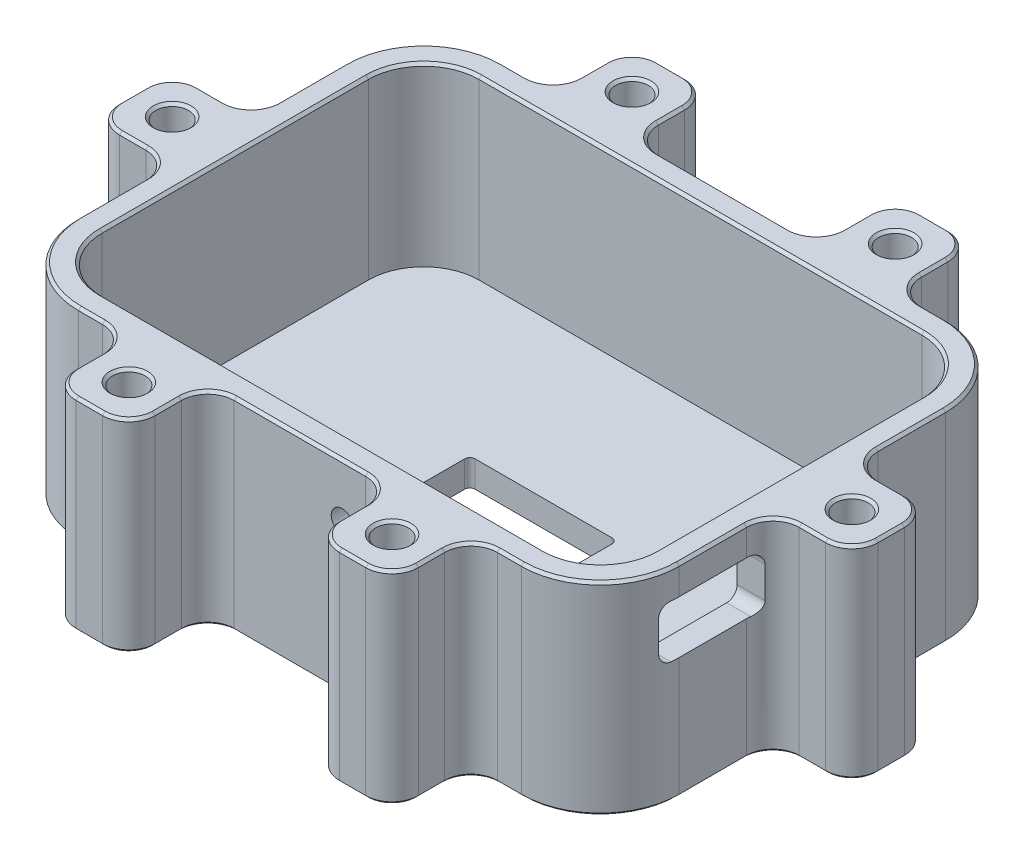
from build123d import *

# Parameters (mm, degrees)
BODY_DELETE_KEEP_START     = 12.456690851
BODY_DELETE_KEEP_1_DEPTH   = 38.5
BODY_DELETE_KEEP_1_2_DEPTH = 5
SKETCH121_W                = 15
SKETCH121_H                = 38.5
BOSS_EXTRUDE1_DEPTH        = 15
SKETCH122_W                = 15
SKETCH122_H                = 38.5
BOSS_EXTRUDE2_DEPTH        = 15
SKETCH123_R                = 3.1
CUT_EXTRUDE1_DEPTH         = 245.273833572
SKETCH124_R                = 3.1
CUT_EXTRUDE2_DEPTH         = 245.273833572
MIRROR3_COPY_1_SKETCH_W    = 15
MIRROR3_COPY_1_SKETCH_H    = 38.5
MIRROR3_COPY_1_DEPTH       = 15
MIRROR3_COPY_2_SKETCH_R    = 3.1
MIRROR3_COPY_2_DEPTH       = 245.273833572
FILLET1_R                  = 5
CHAMFER1_SIZE              = 0.5
SKETCH125_W                = 19
SKETCH125_H                = 10
CUT_EXTRUDE3_DEPTH         = 10
SKETCH127_W                = 28
SKETCH127_H                = 12
CUT_EXTRUDE4_DEPTH         = 5
FILLET2_R                  = 1
SKETCH128_R                = 1.5
CUT_EXTRUDE5_DEPTH         = 4.5
M5X0_8_TAPPED_HOLE1_D      = 4.2
M5X0_8_TAPPED_HOLE1_DEPTH  = 14
M5X0_8_TAPPED_HOLE1_TIP    = 1.2618073
FILLET3_R                  = 2


# Read off the part's stored shape, not the designer's step: Body-Delete/Keep 1
with BuildPart() as part:
    # Body-Delete/Keep 1 outline → Body-Delete/Keep 1 (new body)
    with BuildSketch(Plane(origin=(0, 0, 0), x_dir=(1, 0, 0), z_dir=(0, 1, 0)).offset(BODY_DELETE_KEEP_START)):
        with BuildLine():
            ThreePointArc((-96.863777431, -3.776261632), (-101.257175713, 6.830340086), (-111.863777431, 11.223738368))
            Line((-111.863777431, 11.223738368), (-195.989813257, 11.223738368))
            ThreePointArc((-195.989813257, 11.223738368), (-206.596414975, 6.830340086), (-210.989813257, -3.776261632))
            Line((-210.989813257, -3.776261632), (-210.989813257, -54.356742894))
            ThreePointArc((-210.989813257, -54.356742894), (-206.596414975, -64.963344612), (-195.989813257, -69.356742894))
            Line((-195.989813257, -69.356742894), (-111.863777431, -69.356742894))
            ThreePointArc((-111.863777431, -69.356742894), (-101.257175713, -64.963344612), (-96.863777431, -54.356742894))
            Line((-96.863777431, -54.356742894), (-96.863777431, -3.776261632))
        make_face()
        with BuildLine():
            Line((-195.989813257, 6.723738368), (-111.863777431, 6.723738368))
            ThreePointArc((-111.863777431, 6.723738368), (-104.439156228, 3.648359571), (-101.363777431, -3.776261632))
            Line((-101.363777431, -3.776261632), (-101.363777431, -54.356742894))
            ThreePointArc((-101.363777431, -54.356742894), (-104.439156228, -61.781364097), (-111.863777431, -64.856742894))
            Line((-111.863777431, -64.856742894), (-195.989813257, -64.856742894))
            ThreePointArc((-195.989813257, -64.856742894), (-203.41443446, -61.781364097), (-206.489813257, -54.356742894))
            Line((-206.489813257, -54.356742894), (-206.489813257, -3.776261632))
            ThreePointArc((-206.489813257, -3.776261632), (-203.41443446, 3.648359571), (-195.989813257, 6.723738368))
        make_face(mode=Mode.SUBTRACT)
    extrude(amount=BODY_DELETE_KEEP_1_DEPTH)

    # Body-Delete_Keep 1 2 outline → Body-Delete_Keep 1 2 (add)
    with BuildSketch(Plane(origin=(0, 0, 0), x_dir=(1, 0, 0), z_dir=(0, 1, 0)).offset(BODY_DELETE_KEEP_START)):
        with BuildLine():
            ThreePointArc((-101.363777431, -3.776261632), (-104.439156228, 3.648359571), (-111.863777431, 6.723738368))
            Line((-111.863777431, 6.723738368), (-195.989813257, 6.723738368))
            ThreePointArc((-195.989813257, 6.723738368), (-203.41443446, 3.648359571), (-206.489813257, -3.776261632))
            Line((-206.489813257, -3.776261632), (-206.489813257, -54.356742894))
            ThreePointArc((-206.489813257, -54.356742894), (-203.41443446, -61.781364097), (-195.989813257, -64.856742894))
            Line((-195.989813257, -64.856742894), (-111.863777431, -64.856742894))
            ThreePointArc((-111.863777431, -64.856742894), (-104.439156228, -61.781364097), (-101.363777431, -54.356742894))
            Line((-101.363777431, -54.356742894), (-101.363777431, -3.776261632))
        make_face()
    extrude(amount=BODY_DELETE_KEEP_1_2_DEPTH)

    # Sketch121 → Boss-Extrude1 (add)
    with BuildSketch(Plane.ZY.offset(210.989813257)):
        with Locations((29.066502263, 31.706690851)):
            Rectangle(SKETCH121_W, SKETCH121_H)
    boss_extrude1 = extrude(amount=BOSS_EXTRUDE1_DEPTH)

    # Sketch122 → Boss-Extrude2 (add)
    with BuildSketch(Plane.XY.offset(69.356742894)):
        with Locations((-178.926795344, 31.706690851)):
            Rectangle(SKETCH122_W, SKETCH122_H)
    boss_extrude2 = extrude(amount=BOSS_EXTRUDE2_DEPTH)

    # Sketch123 → Cut-Extrude1 (cut, through all)
    with BuildSketch(Plane(origin=(0, 50.956690851, 0), x_dir=(1, 0, 0), z_dir=(0, 1, 0))):
        with Locations(Location((-218.489813257, -29.066502263, 0), (0, 0, 270))):
            Circle(SKETCH123_R)
    cut_extrude1 = extrude(amount=-CUT_EXTRUDE1_DEPTH, mode=Mode.SUBTRACT)

    # Sketch124 → Cut-Extrude2 (cut, through all)
    with BuildSketch(Plane(origin=(0, 50.956690851, 0), x_dir=(1, 0, 0), z_dir=(0, 1, 0))):
        with Locations(Location((-178.926795344, -76.856742894, 0), (0, 0, 270))):
            Circle(SKETCH124_R)
    cut_extrude2 = extrude(amount=-CUT_EXTRUDE2_DEPTH, mode=Mode.SUBTRACT)

    # Mirror1: Boss-Extrude1, Cut-Extrude1 across plane
    add(boss_extrude1.mirror(Plane.ZY.offset(153.926795344)))
    add(cut_extrude1.mirror(Plane.ZY.offset(153.926795344)), mode=Mode.SUBTRACT)

    # Mirror2: Boss-Extrude2, Cut-Extrude2 across plane
    add(boss_extrude2.mirror(Plane.XY.offset(29.066502263)))
    add(cut_extrude2.mirror(Plane.XY.offset(29.066502263)), mode=Mode.SUBTRACT)

    # Mirror3: Boss-Extrude2, Cut-Extrude2 across plane
    add(boss_extrude2.mirror(Plane.ZY.offset(153.926795344)))
    add(cut_extrude2.mirror(Plane.ZY.offset(153.926795344)), mode=Mode.SUBTRACT)

    # Mirror3 copy 1 sketch → Mirror3 copy 1 (add)
    with BuildSketch(Plane(origin=(-307.853590688, 0, -11.223738368), x_dir=(-1, 0, 0), z_dir=(0, 0, -1))):
        with Locations((-178.926795344, 31.706690851)):
            Rectangle(MIRROR3_COPY_1_SKETCH_W, MIRROR3_COPY_1_SKETCH_H)
    extrude(amount=MIRROR3_COPY_1_DEPTH)

    # Mirror3 copy 2 sketch → Mirror3 copy 2 (cut, through all)
    with BuildSketch(Plane(origin=(-307.853590688, 50.956690851, 58.133004526), x_dir=(-1, 0, 0), z_dir=(0, 1, 0))):
        with Locations(Location((-178.926795344, -76.856742894, 0), (0, 0, 270))):
            Circle(MIRROR3_COPY_2_SKETCH_R)
    extrude(amount=-MIRROR3_COPY_2_DEPTH, mode=Mode.SUBTRACT)

    # Fillet1
    fillet1_edges = [part.edges().sort_by_distance(p)[0] for p in [
        (-81.863777431, 31.706690851, 21.566502263),
        (-81.863777431, 31.706690851, 36.566502263),
        (-96.863777431, 31.706690851, 21.566502263),
        (-96.863777431, 31.706690851, 36.566502263),
        (-186.426795344, 31.706690851, -26.223738368),
        (-171.426795344, 31.706690851, -26.223738368),
        (-186.426795344, 31.706690851, -11.223738368),
        (-171.426795344, 31.706690851, -11.223738368),
        (-121.426795344, 31.706690851, -11.223738368),
        (-136.426795344, 31.706690851, -11.223738368),
        (-121.426795344, 31.706690851, -26.223738368),
        (-136.426795344, 31.706690851, -26.223738368),
        (-121.426795344, 31.706690851, 84.356742894),
        (-136.426795344, 31.706690851, 84.356742894),
        (-121.426795344, 31.706690851, 69.356742894),
        (-136.426795344, 31.706690851, 69.356742894),
        (-210.989813257, 31.706690851, 21.566502263),
        (-210.989813257, 31.706690851, 36.566502263),
        (-225.989813257, 31.706690851, 21.566502263),
        (-225.989813257, 31.706690851, 36.566502263),
        (-186.426795344, 31.706690851, 69.356742894),
        (-171.426795344, 31.706690851, 69.356742894),
        (-186.426795344, 31.706690851, 84.356742894),
        (-171.426795344, 31.706690851, 84.356742894),
    ]]
    fillet(fillet1_edges, radius=FILLET1_R)

    # Chamfer1
    chamfer1_edges = [part.edges().sort_by_distance(p)[0] for p in [
        (-206.596414975, 50.956690851, -6.830340086),
        (-218.489813257, 12.456690851, 25.966502263),
        (-218.489813257, 50.956690851, 25.966502263),
        (-178.926795344, 12.456690851, 73.756742894),
        (-178.926795344, 50.956690851, 73.756742894),
        (-210.989813257, 50.956690851, 47.961622578),
        (-89.363777431, 50.956690851, 25.966502263),
        (-89.363777431, 12.456690851, 25.966502263),
        (-206.596414975, 50.956690851, 64.963344612),
        (-178.926795344, 50.956690851, -15.623738368),
        (-178.926795344, 12.456690851, -15.623738368),
        (-114.145286388, 50.956690851, 69.356742894),
        (-128.926795344, 12.456690851, -15.623738368),
        (-128.926795344, 50.956690851, -15.623738368),
        (-101.257175713, 50.956690851, 64.963344612),
        (-128.926795344, 50.956690851, 73.756742894),
        (-128.926795344, 12.456690851, 73.756742894),
        (-121.426795344, 12.456690851, -18.723738368),
        (-121.426795344, 50.956690851, -18.723738368),
        (-114.145286388, 12.456690851, -11.223738368),
        (-114.145286388, 50.956690851, -11.223738368),
        (-128.926795344, 12.456690851, -26.223738368),
        (-128.926795344, 50.956690851, -26.223738368),
        (-89.363777431, 12.456690851, 21.566502263),
        (-81.863777431, 12.456690851, 29.066502263),
        (-96.863777431, 50.956690851, 10.171381947),
        (-89.363777431, 12.456690851, 36.566502263),
        (-96.863777431, 12.456690851, 47.961622578),
        (-121.426795344, 12.456690851, 76.856742894),
        (-128.926795344, 12.456690851, 84.356742894),
        (-136.426795344, 12.456690851, 76.856742894),
        (-153.926795344, 12.456690851, 69.356742894),
        (-171.426795344, 12.456690851, 76.856742894),
        (-178.926795344, 12.456690851, 84.356742894),
        (-186.426795344, 12.456690851, 76.856742894),
        (-193.708304301, 12.456690851, 69.356742894),
        (-218.489813257, 12.456690851, 36.566502263),
        (-225.989813257, 12.456690851, 29.066502263),
        (-218.489813257, 12.456690851, 21.566502263),
        (-210.989813257, 12.456690851, 10.171381947),
        (-186.426795344, 12.456690851, -18.723738368),
        (-178.926795344, 12.456690851, -26.223738368),
        (-171.426795344, 12.456690851, -18.723738368),
        (-153.926795344, 12.456690851, -11.223738368),
        (-136.426795344, 12.456690851, -18.723738368),
        (-224.525347163, 12.456690851, 35.102036169),
        (-83.328243525, 12.456690851, 23.030968357),
        (-83.328243525, 12.456690851, 35.102036169),
        (-122.891261438, 12.456690851, 82.8922768),
        (-134.96232925, 12.456690851, 82.8922768),
        (-172.891261438, 12.456690851, 82.8922768),
        (-184.96232925, 12.456690851, 82.8922768),
        (-224.525347163, 12.456690851, 23.030968357),
        (-184.96232925, 12.456690851, -24.759272274),
        (-172.891261438, 12.456690851, -24.759272274),
        (-134.96232925, 12.456690851, -24.759272274),
        (-122.891261438, 12.456690851, -24.759272274),
        (-136.426795344, 50.956690851, -18.723738368),
        (-153.926795344, 50.956690851, -11.223738368),
        (-171.426795344, 50.956690851, -18.723738368),
        (-178.926795344, 50.956690851, -26.223738368),
        (-186.426795344, 50.956690851, -18.723738368),
        (-210.989813257, 50.956690851, 10.171381947),
        (-218.489813257, 50.956690851, 21.566502263),
        (-225.989813257, 50.956690851, 29.066502263),
        (-218.489813257, 50.956690851, 36.566502263),
        (-193.708304301, 50.956690851, 69.356742894),
        (-186.426795344, 50.956690851, 76.856742894),
        (-178.926795344, 50.956690851, 84.356742894),
        (-171.426795344, 50.956690851, 76.856742894),
        (-153.926795344, 50.956690851, 69.356742894),
        (-136.426795344, 50.956690851, 76.856742894),
        (-128.926795344, 50.956690851, 84.356742894),
        (-121.426795344, 50.956690851, 76.856742894),
        (-96.863777431, 50.956690851, 47.961622578),
        (-89.363777431, 50.956690851, 36.566502263),
        (-81.863777431, 50.956690851, 29.066502263),
        (-89.363777431, 50.956690851, 21.566502263),
        (-224.525347163, 50.956690851, 35.102036169),
        (-83.328243525, 50.956690851, 23.030968357),
        (-83.328243525, 50.956690851, 35.102036169),
        (-122.891261438, 50.956690851, 82.8922768),
        (-134.96232925, 50.956690851, 82.8922768),
        (-172.891261438, 50.956690851, 82.8922768),
        (-184.96232925, 50.956690851, 82.8922768),
        (-224.525347163, 50.956690851, 23.030968357),
        (-184.96232925, 50.956690851, -24.759272274),
        (-172.891261438, 50.956690851, -24.759272274),
        (-134.96232925, 50.956690851, -24.759272274),
        (-122.891261438, 50.956690851, -24.759272274),
        (-119.96232925, 12.456690851, -12.688204462),
        (-119.96232925, 50.956690851, -12.688204462),
        (-137.891261438, 50.956690851, -12.688204462),
        (-137.891261438, 12.456690851, -12.688204462),
        (-169.96232925, 50.956690851, -12.688204462),
        (-169.96232925, 12.456690851, -12.688204462),
        (-187.891261438, 12.456690851, -12.688204462),
        (-187.891261438, 50.956690851, -12.688204462),
        (-212.454279351, 12.456690851, 20.102036169),
        (-212.454279351, 50.956690851, 20.102036169),
        (-212.454279351, 50.956690851, 38.030968357),
        (-212.454279351, 12.456690851, 38.030968357),
        (-187.891261438, 12.456690851, 70.821208988),
        (-187.891261438, 50.956690851, 70.821208988),
        (-169.96232925, 50.956690851, 70.821208988),
        (-169.96232925, 12.456690851, 70.821208988),
        (-137.891261438, 50.956690851, 70.821208988),
        (-137.891261438, 12.456690851, 70.821208988),
        (-119.96232925, 12.456690851, 70.821208988),
        (-119.96232925, 50.956690851, 70.821208988),
        (-95.399311337, 50.956690851, 38.030968357),
        (-95.399311337, 12.456690851, 38.030968357),
        (-95.399311337, 12.456690851, 20.102036169),
        (-95.399311337, 50.956690851, 20.102036169),
        (-101.257175713, 12.456690851, -6.830340086),
        (-96.863777431, 12.456690851, 10.171381947),
        (-101.257175713, 12.456690851, 64.963344612),
        (-114.145286388, 12.456690851, 69.356742894),
        (-206.596414975, 12.456690851, 64.963344612),
        (-210.989813257, 12.456690851, 47.961622578),
        (-206.596414975, 12.456690851, -6.830340086),
        (-193.708304301, 12.456690851, -11.223738368),
        (-101.257175713, 50.956690851, -6.830340086),
        (-153.926795344, 50.956690851, -6.723738368),
        (-104.439156228, 50.956690851, -3.648359571),
        (-193.708304301, 50.956690851, -11.223738368),
        (-101.363777431, 50.956690851, 29.066502263),
        (-104.439156228, 50.956690851, 61.781364097),
        (-153.926795344, 50.956690851, 64.856742894),
        (-203.41443446, 50.956690851, 61.781364097),
        (-206.489813257, 50.956690851, 29.066502263),
        (-203.41443446, 50.956690851, -3.648359571),
    ]]
    chamfer(chamfer1_edges, length=CHAMFER1_SIZE)

    # Sketch125 → Cut-Extrude3 (cut, symmetric)
    with BuildSketch(Plane(origin=(-96.863777431, 0, 0), x_dir=(0, 0, -1), z_dir=(1, 0, 0))):
        with Locations((-48.356742894, 40.456690851)):
            Rectangle(SKETCH125_W, SKETCH125_H)
    extrude(amount=CUT_EXTRUDE3_DEPTH, both=True, mode=Mode.SUBTRACT)

    # Sketch127 → Cut-Extrude4 (cut)
    with BuildSketch(Plane.XZ.offset(-12.456690851)):
        with Locations((-153.926795344, 29.066502263)):
            Rectangle(SKETCH127_W, SKETCH127_H)
    extrude(amount=-CUT_EXTRUDE4_DEPTH, mode=Mode.SUBTRACT)

    # Fillet2
    fillet2_edges = [part.edges().sort_by_distance(p)[0] for p in [
        (-139.926795344, 14.956690851, 35.066502263),
        (-139.926795344, 14.956690851, 23.066502263),
        (-167.926795344, 14.956690851, 23.066502263),
        (-167.926795344, 14.956690851, 35.066502263),
    ]]
    fillet(fillet2_edges, radius=FILLET2_R)

    # Sketch128 → Cut-Extrude5 (cut)
    with BuildSketch(Plane.XY.offset(69.356742894)):
        with Locations((-145.879813591, 40.831690851)):
            Circle(SKETCH128_R)
    extrude(amount=-CUT_EXTRUDE5_DEPTH, mode=Mode.SUBTRACT)

    # M5x0.8 Tapped Hole1
    with Locations(Plane.XY.offset(69.356742894)):
        with Locations((-145.879813591, 40.831690851)):
            Hole(M5X0_8_TAPPED_HOLE1_D / 2, depth=M5X0_8_TAPPED_HOLE1_DEPTH)
            with Locations((0, 0, -(M5X0_8_TAPPED_HOLE1_DEPTH + M5X0_8_TAPPED_HOLE1_TIP / 2))):  # 118° drill point
                Cone(0, M5X0_8_TAPPED_HOLE1_D / 2, M5X0_8_TAPPED_HOLE1_TIP, mode=Mode.SUBTRACT)

    # Fillet3
    fillet3_edges = [part.edges().sort_by_distance(p)[0] for p in [
        (-99.62105389, 35.456690851, 57.856742894),
        (-99.62105389, 45.456690851, 57.856742894),
        (-98.714801239, 45.456690851, 38.856742894),
        (-98.714801239, 35.456690851, 38.856742894),
    ]]
    fillet(fillet3_edges, radius=FILLET3_R)


solid = part.part
